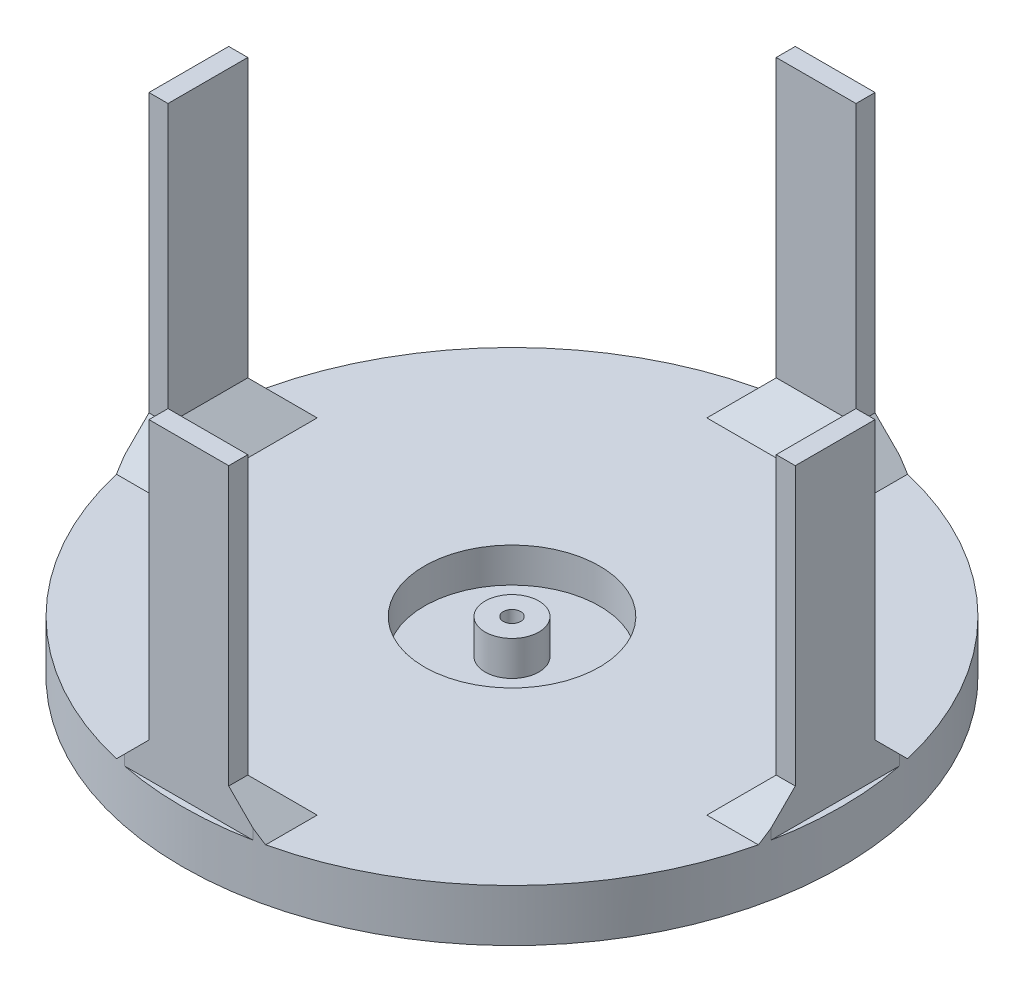
from build123d import *

# Parameters (mm, degrees)
BOSS_EXTRUDE1_DEPTH     = 7.5
SKETCH2_W               = 23
SKETCH2_H               = 5.500000000000014
SKETCH2_W_2             = 5.5
SKETCH2_H_2             = 23
BOSS_EXTRUDE2_DEPTH     = 90
SKETCH3_R               = 25.25
SKETCH3_R_2             = 7.75
CUT_EXTRUDE1_DEPTH      = 10
CUT_EXTRUDE2_DEPTH      = 162.70961628796235
CUT_EXTRUDE2_DEPTH_BACK = 162.70961628796235
SKETCH4_R               = 2.5
CHAMFER1_SIZE           = 10


with BuildPart() as part:
    # Sketch1 → Boss-Extrude1 (new, symmetric)
    with BuildSketch(Plane(origin=(0, 0, 0), x_dir=(1, 0, 0), z_dir=(0, 1, 0))):
        with BuildLine():
            ThreePointArc((-9.98613997947909, 94.47368421052632), (-82.27241335952168, 47.49999999999999), (-86.80968050516414, -38.58859119728691))
            ThreePointArc((-86.80968050516414, -38.58859119728691), (-82.27241335952166, -47.500000000000036), (-76.82354052568505, -55.885093013239505))
            ThreePointArc((-76.82354052568505, -55.885093013239505), (4.801e-14, -95.00000000000001), (76.82354052568508, -55.88509301323945))
            ThreePointArc((76.82354052568508, -55.88509301323945), (82.2724133595217, -47.499999999999986), (86.80968050516417, -38.58859119728684))
            ThreePointArc((86.80968050516417, -38.58859119728684), (82.27241335952168, 47.50000000000001), (9.986139979479082, 94.47368421052632))
            ThreePointArc((9.986139979479082, 94.47368421052632), (5.82e-15, 95), (-9.98613997947909, 94.47368421052632))
        make_face()
    extrude(amount=BOSS_EXTRUDE1_DEPTH, both=True)

    # Sketch2 → Boss-Extrude2 (add)
    with BuildSketch(Plane(origin=(0, 7.5, 0), x_dir=(1, 0, 0), z_dir=(0, 1, 0))):
        with Locations((0, 90.42404100918682)):
            Rectangle(SKETCH2_W, SKETCH2_H)
        with Locations((90.42404100918962, 2.14584e-12)):
            Rectangle(SKETCH2_W_2, SKETCH2_H_2)
        Polygon((11.50000000000496, -93.17404100918749), (-11.49999999999504, -93.17404100918749), (-11.499999999995042, -87.67404100918748), (11.500000000004958, -87.67404100918748), align=None)
        Polygon((-93.17404100918469, -11.500000000002824), (-93.17404100918469, 11.499999999997176), (-87.67404100918468, 11.499999999997177), (-87.67404100918468, -11.500000000002823), align=None)
    extrude(amount=BOSS_EXTRUDE2_DEPTH)

    # Sketch3 → Cut-Extrude1 (cut)
    with BuildSketch(Plane(origin=(0, 7.5, 0), x_dir=(1, 0, 0), z_dir=(0, 1, 0))):
        with Locations(Location((0, 0, 0), (0, 0, 270))):
            Circle(SKETCH3_R)
        with Locations(Location((0, 0, 0), (0, 0, 270))):
            Circle(SKETCH3_R_2, mode=Mode.SUBTRACT)
    extrude(amount=-CUT_EXTRUDE1_DEPTH, mode=Mode.SUBTRACT)

    # Sketch4 → Cut-Extrude2 (cut, two sides: drawn at the far end of the back side and taken through both)
    with BuildSketch(Plane(origin=(0, 7.5, 0), x_dir=(1, 0, 0), z_dir=(0, 1, 0)).offset(-CUT_EXTRUDE2_DEPTH_BACK)):
        with Locations(Location((0, 0, 0), (0, 0, 270))):
            Circle(SKETCH4_R)
    extrude(amount=CUT_EXTRUDE2_DEPTH + CUT_EXTRUDE2_DEPTH_BACK, mode=Mode.SUBTRACT)

    # Chamfer1
    # the kernel refuses this chamfer: 10 mm, written as the material it adds along each edge
    with BuildSketch(Plane(origin=(-11.5, 7.5, -87.67404100918681), x_dir=(-0.9996219169112968, -0.027495876610586403, 0), z_dir=(0, 0, -1))) as chamfer1_piece_1_section:
        Polygon((CHAMFER1_SIZE * 0.999621916911, CHAMFER1_SIZE * 0.0274958766106), (-CHAMFER1_SIZE * 0.0274958766106, CHAMFER1_SIZE * 0.999621916911), (0, 0), align=None)
    chamfer1_piece_1 = extrude(amount=5.500000000000014, mode=Mode.PRIVATE)
    chamfer1_piece_1 = chamfer1_piece_1 & Plane(origin=(-7.11e-15, 10.81050074609558, 2.265e-14), x_dir=(-0.10511726294188506, 0, -0.9944598337950139), z_dir=(0, -1, 0)) * Cylinder(95, 51, mode=Mode.PRIVATE)
    add(chamfer1_piece_1)
    with BuildSketch(Plane(origin=(11.5, 7.5, -87.67404100918681), x_dir=(0, -0.027495876610586403, 0.9996219169112968), z_dir=(-1, 0, 0)), Plane(origin=(87.67404100918962, 7.5, 11.499999999997854), x_dir=(-0.9996219169112968, -0.027495876610586403, 0), z_dir=(0, 0, -1)), Plane(origin=(-11.499999999995042, 7.5, 87.67404100918748), x_dir=(0, -0.027495876610586403, -0.9996219169112968), z_dir=(1, 0, 0)), Plane(origin=(-87.67404100918468, 7.5, -11.499999999997177), x_dir=(0.9996219169112968, -0.027495876610586403, 0), z_dir=(0, 0, 1))) as chamfer1_piece_2:
        Polygon((CHAMFER1_SIZE * 0.999621916911, CHAMFER1_SIZE * 0.0274958766106), (-CHAMFER1_SIZE * 0.0274958766106, CHAMFER1_SIZE * 0.999621916911), (0, 0), align=None)
    extrude(amount=23)
    with BuildSketch(Plane(origin=(11.5, 7.5, -93.17404100918682), x_dir=(0.9996219169112968, -0.027495876610586403, 0), z_dir=(0, 0, 1))) as chamfer1_piece_3_section:
        Polygon((CHAMFER1_SIZE * 0.999621916911, CHAMFER1_SIZE * 0.0274958766106), (-CHAMFER1_SIZE * 0.0274958766106, CHAMFER1_SIZE * 0.999621916911), (0, 0), align=None)
    chamfer1_piece_3 = extrude(amount=5.500000000000014, mode=Mode.PRIVATE)
    chamfer1_piece_3 = chamfer1_piece_3 & Plane(origin=(-7.11e-15, 10.810500746107277, 1.066e-14), x_dir=(0.9137861105806754, 0, 0.4061956968135455), z_dir=(0, -1, 0)) * Cylinder(95.00000000000001, 51, mode=Mode.PRIVATE)
    add(chamfer1_piece_3)
    with BuildSketch(Plane(origin=(87.67404100918962, 7.5, -11.500000000002146), x_dir=(0, -0.027495876610586403, -0.9996219169112968), z_dir=(1, 0, 0))) as chamfer1_piece_4_section:
        Polygon((CHAMFER1_SIZE * 0.999621916911, CHAMFER1_SIZE * 0.0274958766106), (-CHAMFER1_SIZE * 0.0274958766106, CHAMFER1_SIZE * 0.999621916911), (0, 0), align=None)
    chamfer1_piece_4 = extrude(amount=5.500000000000014, mode=Mode.PRIVATE)
    chamfer1_piece_4 = chamfer1_piece_4 & Plane(origin=(-7.11e-15, 10.81050074609573, 1.066e-14), x_dir=(0.9137861105806754, 0, 0.4061956968135455), z_dir=(0, -1, 0)) * Cylinder(95.00000000000001, 51, mode=Mode.PRIVATE)
    add(chamfer1_piece_4)
    with BuildSketch(Plane(origin=(93.17404100918964, 7.5, 11.499999999997854), x_dir=(0, -0.027495876610586403, 0.9996219169112968), z_dir=(-1, 0, 0))) as chamfer1_piece_5_section:
        Polygon((CHAMFER1_SIZE * 0.999621916911, CHAMFER1_SIZE * 0.0274958766106), (-CHAMFER1_SIZE * 0.0274958766106, CHAMFER1_SIZE * 0.999621916911), (0, 0), align=None)
    chamfer1_piece_5 = extrude(amount=5.500000000000014, mode=Mode.PRIVATE)
    chamfer1_piece_5 = chamfer1_piece_5 & Plane(origin=(-7.11e-15, 10.81050074610739, 1.066e-14), x_dir=(0.9137861105806754, 0, 0.4061956968135455), z_dir=(0, -1, 0)) * Cylinder(95.00000000000001, 51, mode=Mode.PRIVATE)
    add(chamfer1_piece_5)
    with BuildSketch(Plane(origin=(11.500000000004958, 7.5, 87.67404100918748), x_dir=(0.9996219169112968, -0.0274958766105864, 0), z_dir=(3.2e-16, 0, 1))) as chamfer1_piece_6_section:
        Polygon((CHAMFER1_SIZE * 0.999621916911, CHAMFER1_SIZE * 0.0274958766106), (-CHAMFER1_SIZE * 0.0274958766106, CHAMFER1_SIZE * 0.999621916911), (0, 0), align=None)
    chamfer1_piece_6 = extrude(amount=5.500000000000014, mode=Mode.PRIVATE)
    chamfer1_piece_6 = chamfer1_piece_6 & Plane(origin=(-7.11e-15, 10.810500746095684, 4.263e-14), x_dir=(-0.8086688476387901, 0, 0.5882641369814681), z_dir=(0, -1, 0)) * Cylinder(94.99999999999999, 51, mode=Mode.PRIVATE)
    add(chamfer1_piece_6)
    with BuildSketch(Plane(origin=(-11.49999999999504, 7.5, 93.17404100918749), x_dir=(-0.9996219169112968, -0.027495876610586403, 0), z_dir=(-3.2e-16, 0, -1))) as chamfer1_piece_7_section:
        Polygon((CHAMFER1_SIZE * 0.999621916911, CHAMFER1_SIZE * 0.0274958766106), (-CHAMFER1_SIZE * 0.0274958766106, CHAMFER1_SIZE * 0.999621916911), (0, 0), align=None)
    chamfer1_piece_7 = extrude(amount=5.500000000000014, mode=Mode.PRIVATE)
    chamfer1_piece_7 = chamfer1_piece_7 & Plane(origin=(-7.11e-15, 10.810500746107264, 4.263e-14), x_dir=(-0.8086688476387901, 0, 0.5882641369814681), z_dir=(0, -1, 0)) * Cylinder(94.99999999999999, 51, mode=Mode.PRIVATE)
    add(chamfer1_piece_7)
    with BuildSketch(Plane(origin=(-87.67404100918468, 7.5, 11.500000000002823), x_dir=(0, -0.02749587661058641, 0.9996219169112968), z_dir=(-1, 0, 3.2e-16))) as chamfer1_piece_8_section:
        Polygon((CHAMFER1_SIZE * 0.999621916911, CHAMFER1_SIZE * 0.0274958766106), (-CHAMFER1_SIZE * 0.0274958766106, CHAMFER1_SIZE * 0.999621916911), (0, 0), align=None)
    chamfer1_piece_8 = extrude(amount=5.500000000000014, mode=Mode.PRIVATE)
    chamfer1_piece_8 = chamfer1_piece_8 & Plane(origin=(-7.11e-15, 10.8105007460955, 2.265e-14), x_dir=(-0.10511726294188506, 0, -0.9944598337950139), z_dir=(0, -1, 0)) * Cylinder(95, 51, mode=Mode.PRIVATE)
    add(chamfer1_piece_8)
    with BuildSketch(Plane(origin=(-93.17404100918469, 7.5, -11.499999999997176), x_dir=(0, -0.027495876610586403, -0.9996219169112968), z_dir=(1, 0, -3.2e-16))) as chamfer1_piece_9_section:
        Polygon((CHAMFER1_SIZE * 0.999621916911, CHAMFER1_SIZE * 0.0274958766106), (-CHAMFER1_SIZE * 0.0274958766106, CHAMFER1_SIZE * 0.999621916911), (0, 0), align=None)
    chamfer1_piece_9 = extrude(amount=5.500000000000014, mode=Mode.PRIVATE)
    chamfer1_piece_9 = chamfer1_piece_9 & Plane(origin=(-7.11e-15, 10.810500746107152, 2.265e-14), x_dir=(-0.10511726294188506, 0, -0.9944598337950139), z_dir=(0, -1, 0)) * Cylinder(95, 51, mode=Mode.PRIVATE)
    add(chamfer1_piece_9)
    with BuildSketch(Plane(origin=(-11.5, 7.5, -61.9572111295277), x_dir=(-0.9996219169112968, -0.027495876610586403, 0), z_dir=(0, 0, -1))) as chamfer1_piece_10a_section:
        Polygon((CHAMFER1_SIZE * 0.999621916911, CHAMFER1_SIZE * 0.0274958766106), (-CHAMFER1_SIZE * 0.0274958766106, CHAMFER1_SIZE * 0.999621916911), (0, 0), align=None)
    chamfer1_piece_10a = extrude(amount=31.216829879659123, mode=Mode.PRIVATE)
    chamfer1_piece_10a = split(chamfer1_piece_10a, bisect_by=Plane(origin=(-14.797936268059384, 10.797936268059397, -87.67404100918681), z_dir=(0, 0, 1)), keep=Keep.TOP, mode=Mode.PRIVATE)
    with BuildSketch(Plane(origin=(11.5, 7.5, -87.67404100918681), x_dir=(0, -0.027495876610586403, 0.9996219169112968), z_dir=(-1, 0, 0))) as chamfer1_piece_10b_section:
        Polygon((CHAMFER1_SIZE * 0.999621916911, CHAMFER1_SIZE * 0.0274958766106), (-CHAMFER1_SIZE * 0.0274958766106, CHAMFER1_SIZE * 0.999621916911), (0, 0), align=None)
    chamfer1_piece_10b = extrude(amount=48.7168298796591, mode=Mode.PRIVATE)
    chamfer1_piece_10b = chamfer1_piece_10b & Plane(origin=(-7.11e-15, 10.791626424571733, 1.066e-14), x_dir=(0.9137861105806754, 0, 0.4061956968135455), z_dir=(0, -1, 0)) * Cylinder(95.00000000000001, 138, mode=Mode.PRIVATE)
    chamfer1_piece_10b = split(chamfer1_piece_10b, bisect_by=Plane(origin=(-11.5, 10.791626424571733, -84.36813075127401), z_dir=(-1, 0, 0)), keep=Keep.TOP, mode=Mode.PRIVATE)
    chamfer1_piece_10 = chamfer1_piece_10a & chamfer1_piece_10b
    add(chamfer1_piece_10)
    with BuildSketch(Plane(origin=(37.2168298796591, 7.5, -87.67404100918681), x_dir=(0, -0.027495876610586403, 0.9996219169112968), z_dir=(-1, 0, 0))) as chamfer1_piece_11a_section:
        Polygon((CHAMFER1_SIZE * 0.999621916911, CHAMFER1_SIZE * 0.0274958766106), (-CHAMFER1_SIZE * 0.0274958766106, CHAMFER1_SIZE * 0.999621916911), (0, 0), align=None)
    chamfer1_piece_11a = extrude(amount=48.7168298796591, mode=Mode.PRIVATE)
    chamfer1_piece_11a = chamfer1_piece_11a & Plane(origin=(-7.11e-15, 10.791626424554309, 1.066e-14), x_dir=(0.9137861105806754, 0, 0.4061956968135455), z_dir=(0, -1, 0)) * Cylinder(95.00000000000001, 138, mode=Mode.PRIVATE)
    chamfer1_piece_11a = split(chamfer1_piece_11a, bisect_by=Plane(origin=(11.5, 10.791626424554309, -84.36813075125882), z_dir=(1, 0, 0)), keep=Keep.TOP, mode=Mode.PRIVATE)
    with BuildSketch(Plane(origin=(11.5, 7.5, -93.17404100918682), x_dir=(0.9996219169112968, -0.027495876610586403, 0), z_dir=(0, 0, 1))) as chamfer1_piece_11b_section:
        Polygon((CHAMFER1_SIZE * 0.999621916911, CHAMFER1_SIZE * 0.0274958766106), (-CHAMFER1_SIZE * 0.0274958766106, CHAMFER1_SIZE * 0.999621916911), (0, 0), align=None)
    chamfer1_piece_11b = extrude(amount=31.216829879659123, mode=Mode.PRIVATE)
    chamfer1_piece_11b = split(chamfer1_piece_11b, bisect_by=Plane(origin=(14.797936268059384, 10.797936268059397, -87.67404100918681), z_dir=(0, 0, 1)), keep=Keep.TOP, mode=Mode.PRIVATE)
    chamfer1_piece_11 = chamfer1_piece_11a & chamfer1_piece_11b
    add(chamfer1_piece_11)
    with BuildSketch(Plane(origin=(61.95721112953051, 7.5, -11.500000000002146), x_dir=(0, -0.027495876610586403, -0.9996219169112968), z_dir=(1, 0, 0))) as chamfer1_piece_12a_section:
        Polygon((CHAMFER1_SIZE * 0.999621916911, CHAMFER1_SIZE * 0.0274958766106), (-CHAMFER1_SIZE * 0.0274958766106, CHAMFER1_SIZE * 0.999621916911), (0, 0), align=None)
    chamfer1_piece_12a = extrude(amount=31.216829879659123, mode=Mode.PRIVATE)
    chamfer1_piece_12a = split(chamfer1_piece_12a, bisect_by=Plane(origin=(87.67404100918962, 10.797936268059399, -14.797936268061527), z_dir=(-1, 0, 0)), keep=Keep.TOP, mode=Mode.PRIVATE)
    with BuildSketch(Plane(origin=(87.67404100918962, 7.5, 11.499999999997854), x_dir=(-0.9996219169112968, -0.027495876610586403, 0), z_dir=(0, 0, -1))) as chamfer1_piece_12b_section:
        Polygon((CHAMFER1_SIZE * 0.999621916911, CHAMFER1_SIZE * 0.0274958766106), (-CHAMFER1_SIZE * 0.0274958766106, CHAMFER1_SIZE * 0.999621916911), (0, 0), align=None)
    chamfer1_piece_12b = extrude(amount=48.7168298796591, mode=Mode.PRIVATE)
    chamfer1_piece_12b = chamfer1_piece_12b & Plane(origin=(-7.11e-15, 10.791626424571684, 1.066e-14), x_dir=(0.9137861105806754, 0, 0.4061956968135455), z_dir=(0, -1, 0)) * Cylinder(95.00000000000001, 138, mode=Mode.PRIVATE)
    chamfer1_piece_12b = split(chamfer1_piece_12b, bisect_by=Plane(origin=(84.36813075127668, 10.791626424571684, -11.500000000002146), z_dir=(0, 0, -1)), keep=Keep.TOP, mode=Mode.PRIVATE)
    chamfer1_piece_12 = chamfer1_piece_12a & chamfer1_piece_12b
    add(chamfer1_piece_12)
    with BuildSketch(Plane(origin=(87.67404100918962, 7.5, 37.216829879656956), x_dir=(-0.9996219169112968, -0.027495876610586403, 0), z_dir=(0, 0, -1))) as chamfer1_piece_13a_section:
        Polygon((CHAMFER1_SIZE * 0.999621916911, CHAMFER1_SIZE * 0.0274958766106), (-CHAMFER1_SIZE * 0.0274958766106, CHAMFER1_SIZE * 0.999621916911), (0, 0), align=None)
    chamfer1_piece_13a = extrude(amount=48.7168298796591, mode=Mode.PRIVATE)
    chamfer1_piece_13a = chamfer1_piece_13a & Plane(origin=(-7.11e-15, 10.791626424553938, 1.066e-14), x_dir=(0.9137861105806754, 0, 0.4061956968135455), z_dir=(0, -1, 0)) * Cylinder(95.00000000000001, 138, mode=Mode.PRIVATE)
    chamfer1_piece_13a = split(chamfer1_piece_13a, bisect_by=Plane(origin=(84.36813075126396, 10.791626424553938, 11.499999999997854), z_dir=(0, 0, 1)), keep=Keep.TOP, mode=Mode.PRIVATE)
    with BuildSketch(Plane(origin=(93.17404100918964, 7.5, 11.499999999997854), x_dir=(0, -0.027495876610586403, 0.9996219169112968), z_dir=(-1, 0, 0))) as chamfer1_piece_13b_section:
        Polygon((CHAMFER1_SIZE * 0.999621916911, CHAMFER1_SIZE * 0.0274958766106), (-CHAMFER1_SIZE * 0.0274958766106, CHAMFER1_SIZE * 0.999621916911), (0, 0), align=None)
    chamfer1_piece_13b = extrude(amount=31.216829879659123, mode=Mode.PRIVATE)
    chamfer1_piece_13b = split(chamfer1_piece_13b, bisect_by=Plane(origin=(87.67404100918962, 10.797936268059402, 14.79793626805724), z_dir=(-1, 0, 0)), keep=Keep.TOP, mode=Mode.PRIVATE)
    chamfer1_piece_13 = chamfer1_piece_13a & chamfer1_piece_13b
    add(chamfer1_piece_13)
    with BuildSketch(Plane(origin=(11.500000000004949, 7.5, 61.95721112952837), x_dir=(0.9996219169112968, -0.027495876610586403, 0), z_dir=(3.2e-16, 0, 1))) as chamfer1_piece_14a_section:
        Polygon((CHAMFER1_SIZE * 0.999621916911, CHAMFER1_SIZE * 0.0274958766106), (-CHAMFER1_SIZE * 0.0274958766106, CHAMFER1_SIZE * 0.999621916911), (0, 0), align=None)
    chamfer1_piece_14a = extrude(amount=31.216829879659123, mode=Mode.PRIVATE)
    chamfer1_piece_14a = split(chamfer1_piece_14a, bisect_by=Plane(origin=(14.797936268064339, 10.797936268059399, 87.67404100918748), z_dir=(0, 0, -1)), keep=Keep.TOP, mode=Mode.PRIVATE)
    with BuildSketch(Plane(origin=(-11.499999999995042, 7.5, 87.67404100918748), x_dir=(0, -0.027495876610586403, -0.9996219169112968), z_dir=(1, 0, 0))) as chamfer1_piece_14b_section:
        Polygon((CHAMFER1_SIZE * 0.999621916911, CHAMFER1_SIZE * 0.0274958766106), (-CHAMFER1_SIZE * 0.0274958766106, CHAMFER1_SIZE * 0.999621916911), (0, 0), align=None)
    chamfer1_piece_14b = extrude(amount=48.7168298796591, mode=Mode.PRIVATE)
    chamfer1_piece_14b = chamfer1_piece_14b & Plane(origin=(-7.11e-15, 10.791626424571755, 4.263e-14), x_dir=(-0.8086688476387901, 0, 0.5882641369814681), z_dir=(0, -1, 0)) * Cylinder(94.99999999999999, 138, mode=Mode.PRIVATE)
    chamfer1_piece_14b = split(chamfer1_piece_14b, bisect_by=Plane(origin=(11.500000000004956, 10.791626424571755, 84.3681307512747), z_dir=(1, 0, -3.2e-16)), keep=Keep.TOP, mode=Mode.PRIVATE)
    chamfer1_piece_14 = chamfer1_piece_14a & chamfer1_piece_14b
    add(chamfer1_piece_14)
    with BuildSketch(Plane(origin=(-37.21682987965415, 7.5, 87.67404100918748), x_dir=(0, -0.027495876610586403, -0.9996219169112968), z_dir=(1, 0, 0))) as chamfer1_piece_15a_section:
        Polygon((CHAMFER1_SIZE * 0.999621916911, CHAMFER1_SIZE * 0.0274958766106), (-CHAMFER1_SIZE * 0.0274958766106, CHAMFER1_SIZE * 0.999621916911), (0, 0), align=None)
    chamfer1_piece_15a = extrude(amount=48.71682987965911, mode=Mode.PRIVATE)
    chamfer1_piece_15a = chamfer1_piece_15a & Plane(origin=(-7.11e-15, 10.791626424554186, 4.263e-14), x_dir=(-0.8086688476387901, 0, 0.5882641369814681), z_dir=(0, -1, 0)) * Cylinder(94.99999999999999, 138, mode=Mode.PRIVATE)
    chamfer1_piece_15a = split(chamfer1_piece_15a, bisect_by=Plane(origin=(-11.499999999995044, 10.791626424554186, 84.36813075126142), z_dir=(-1, 0, 3.2e-16)), keep=Keep.TOP, mode=Mode.PRIVATE)
    with BuildSketch(Plane(origin=(-11.49999999999504, 7.5, 93.17404100918749), x_dir=(-0.9996219169112968, -0.027495876610586403, 0), z_dir=(-3.2e-16, 0, -1))) as chamfer1_piece_15b_section:
        Polygon((CHAMFER1_SIZE * 0.999621916911, CHAMFER1_SIZE * 0.0274958766106), (-CHAMFER1_SIZE * 0.0274958766106, CHAMFER1_SIZE * 0.999621916911), (0, 0), align=None)
    chamfer1_piece_15b = extrude(amount=31.216829879659123, mode=Mode.PRIVATE)
    chamfer1_piece_15b = split(chamfer1_piece_15b, bisect_by=Plane(origin=(-14.797936268054428, 10.797936268059393, 87.67404100918748), z_dir=(0, 0, -1)), keep=Keep.TOP, mode=Mode.PRIVATE)
    chamfer1_piece_15 = chamfer1_piece_15a & chamfer1_piece_15b
    add(chamfer1_piece_15)
    with BuildSketch(Plane(origin=(-61.95721112952557, 7.5, 11.500000000002814), x_dir=(0, -0.027495876610586403, 0.9996219169112968), z_dir=(-1, 0, 3.2e-16))) as chamfer1_piece_16a_section:
        Polygon((CHAMFER1_SIZE * 0.999621916911, CHAMFER1_SIZE * 0.0274958766106), (-CHAMFER1_SIZE * 0.0274958766106, CHAMFER1_SIZE * 0.999621916911), (0, 0), align=None)
    chamfer1_piece_16a = extrude(amount=31.216829879659123, mode=Mode.PRIVATE)
    chamfer1_piece_16a = split(chamfer1_piece_16a, bisect_by=Plane(origin=(-87.67404100918468, 10.7979362680594, 14.797936268062196), z_dir=(1, 0, 0)), keep=Keep.TOP, mode=Mode.PRIVATE)
    with BuildSketch(Plane(origin=(-87.67404100918468, 7.5, -11.499999999997177), x_dir=(0.9996219169112968, -0.027495876610586403, 0), z_dir=(0, 0, 1))) as chamfer1_piece_16b_section:
        Polygon((CHAMFER1_SIZE * 0.999621916911, CHAMFER1_SIZE * 0.0274958766106), (-CHAMFER1_SIZE * 0.0274958766106, CHAMFER1_SIZE * 0.999621916911), (0, 0), align=None)
    chamfer1_piece_16b = extrude(amount=48.7168298796591, mode=Mode.PRIVATE)
    chamfer1_piece_16b = chamfer1_piece_16b & Plane(origin=(-7.11e-15, 10.791626424571803, 2.265e-14), x_dir=(-0.10511726294188506, 0, -0.9944598337950139), z_dir=(0, -1, 0)) * Cylinder(95, 138, mode=Mode.PRIVATE)
    chamfer1_piece_16b = split(chamfer1_piece_16b, bisect_by=Plane(origin=(-84.36813075127199, 10.791626424571803, 11.50000000000282), z_dir=(3.2e-16, 0, 1)), keep=Keep.TOP, mode=Mode.PRIVATE)
    chamfer1_piece_16 = chamfer1_piece_16a & chamfer1_piece_16b
    add(chamfer1_piece_16)
    with BuildSketch(Plane(origin=(-87.67404100918468, 7.5, -37.21682987965628), x_dir=(0.9996219169112968, -0.027495876610586403, 0), z_dir=(0, 0, 1))) as chamfer1_piece_17a_section:
        Polygon((CHAMFER1_SIZE * 0.999621916911, CHAMFER1_SIZE * 0.0274958766106), (-CHAMFER1_SIZE * 0.0274958766106, CHAMFER1_SIZE * 0.999621916911), (0, 0), align=None)
    chamfer1_piece_17a = extrude(amount=48.7168298796591, mode=Mode.PRIVATE)
    chamfer1_piece_17a = chamfer1_piece_17a & Plane(origin=(-7.11e-15, 10.791626424554211, 2.265e-14), x_dir=(-0.10511726294188506, 0, -0.9944598337950139), z_dir=(0, -1, 0)) * Cylinder(95, 138, mode=Mode.PRIVATE)
    chamfer1_piece_17a = split(chamfer1_piece_17a, bisect_by=Plane(origin=(-84.36813075125824, 10.791626424554211, -11.49999999999718), z_dir=(-3.2e-16, 0, -1)), keep=Keep.TOP, mode=Mode.PRIVATE)
    with BuildSketch(Plane(origin=(-93.17404100918469, 7.5, -11.499999999997176), x_dir=(0, -0.027495876610586403, -0.9996219169112968), z_dir=(1, 0, -3.2e-16))) as chamfer1_piece_17b_section:
        Polygon((CHAMFER1_SIZE * 0.999621916911, CHAMFER1_SIZE * 0.0274958766106), (-CHAMFER1_SIZE * 0.0274958766106, CHAMFER1_SIZE * 0.999621916911), (0, 0), align=None)
    chamfer1_piece_17b = extrude(amount=31.216829879659123, mode=Mode.PRIVATE)
    chamfer1_piece_17b = split(chamfer1_piece_17b, bisect_by=Plane(origin=(-87.67404100918468, 10.797936268059397, -14.79793626805656), z_dir=(1, 0, 0)), keep=Keep.TOP, mode=Mode.PRIVATE)
    chamfer1_piece_17 = chamfer1_piece_17a & chamfer1_piece_17b
    add(chamfer1_piece_17)


solid = part.part
